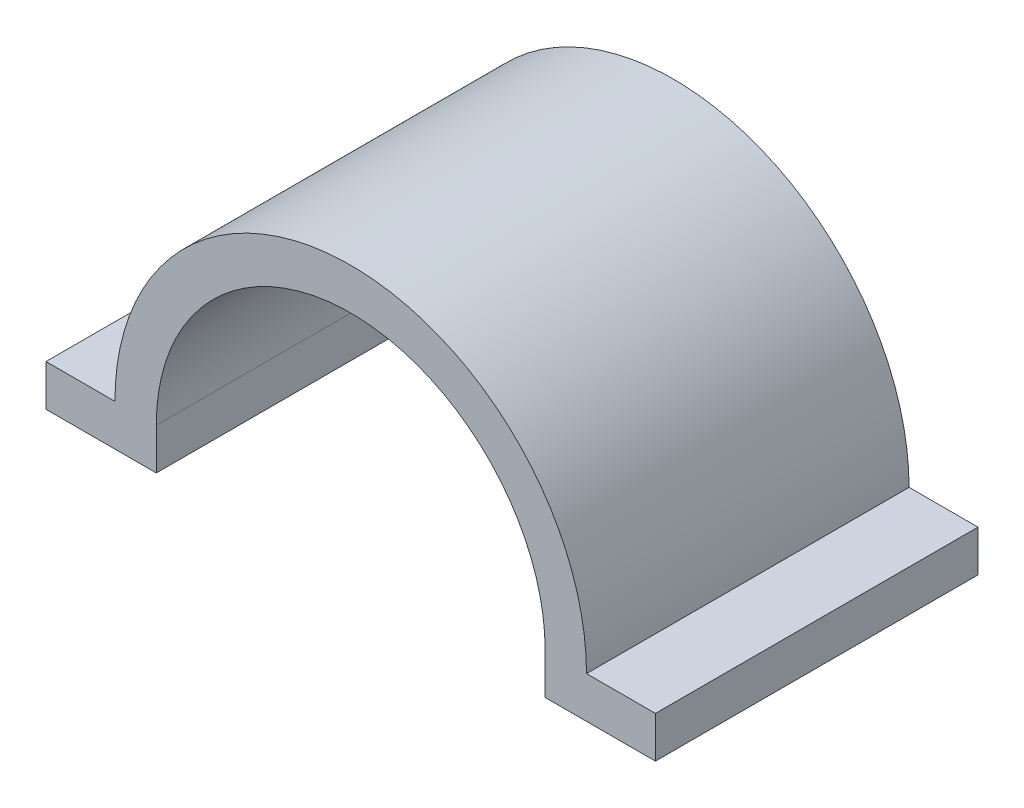
from build123d import *

# Parameters (mm, degrees)
BOSS_EXTRUDE1_DEPTH = 23.4


with BuildPart() as part:
    # Sketch1 → Boss-Extrude1 (new body)
    with BuildSketch(Plane.XY):
        with BuildLine():
            Line((-17.103149726, 0), (-22.103149726, 0))
            Line((-22.103149726, 0), (-22.103149726, -3))
            Line((-22.103149726, -3), (-14.103149726, -3))
            Line((-14.103149726, -3), (-14.103149726, 0))
            ThreePointArc((-14.103149726, 0), (0, 14.103149726), (14.103149726, 0))
            Line((14.103149726, 0), (14.103149726, -3))
            Line((14.103149726, -3), (22.103149726, -3))
            Line((22.103149726, -3), (22.103149726, 0))
            Line((22.103149726, 0), (17.103149726, 0))
            ThreePointArc((17.103149726, 0), (0, 17.103149726), (-17.103149726, 0))
        make_face()
    extrude(amount=BOSS_EXTRUDE1_DEPTH)


solid = part.part
